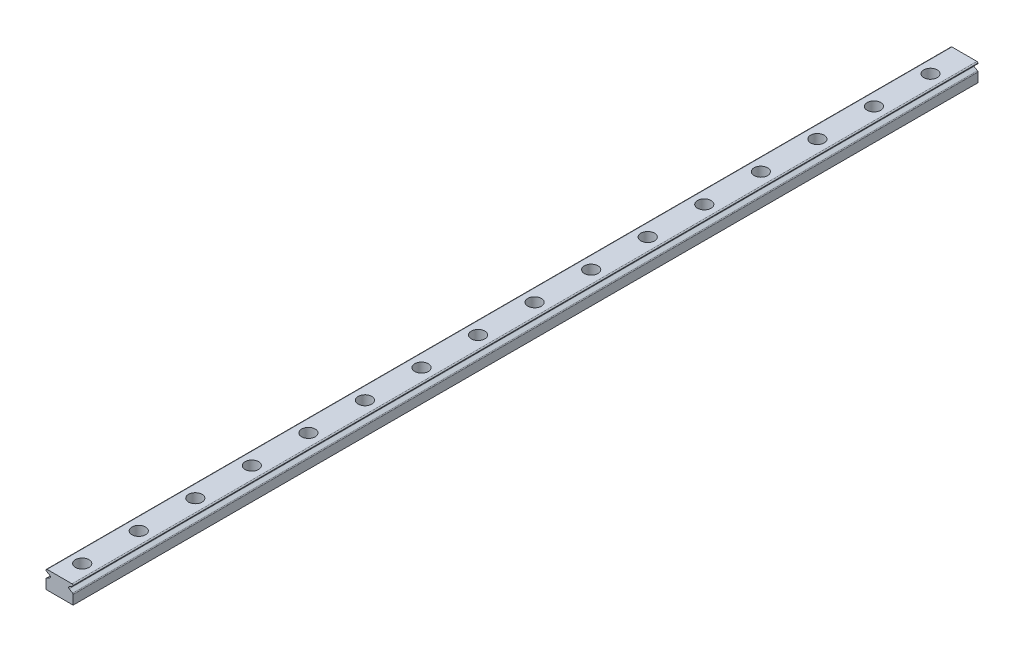
from build123d import *

# Parameters (mm, degrees)
BOSS_EXTRUDE2_DEPTH = 400
FILLET5_R           = 0.5
SKETCH3_R           = 3
CUT_EXTRUDE2_DEPTH  = 4.5
SKETCH4_R           = 1.75
CUT_EXTRUDE3_DEPTH  = 14.5
SKETCH5_W           = 12
SKETCH5_H           = 4.057387372
CUT_EXTRUDE4_DEPTH  = 682.5


with BuildPart() as part:
    # Sketch1 → Boss-Extrude2 (new body)
    with BuildSketch(Plane.XY):
        Polygon((0, 0), (12, 0), (12, 8.403449878), (9.5, 9.846825551), (12, 11.290201224), (12, 12), (0, 12), (0, 11.290201224), (2.5, 9.846825551), (0, 8.403449878), align=None)
    extrude(amount=BOSS_EXTRUDE2_DEPTH)

    # Fillet5
    # the kernel refuses this fillet: 0.5 mm, written as the material it adds along each edge
    with BuildSketch(Plane(origin=(2.5, 9.846825551, 0), x_dir=(-0.8660254037844382, 0.5000000000000009, 0), z_dir=(0, 0, 1)), Plane(origin=(9.5, 9.846825551, 0), x_dir=(0.8660254037844379, -0.5000000000000013, 0), z_dir=(0, 0, 1))) as fillet5_piece_1:
        with BuildLine():
            CenterArc((FILLET5_R * 1.73205080757, FILLET5_R), FILLET5_R, 150, 120)
            Line((FILLET5_R * 0.866025403784, FILLET5_R * 1.5), (0, 0))
            Line((0, 0), (FILLET5_R * 1.73205080757, 0))
        make_face()
    extrude(amount=400)
    # the kernel refuses this fillet: 0.5 mm, written as the material it takes off along each edge
    with BuildSketch(Plane(origin=(0, 8.403449878, -0.721687836), x_dir=(0, -1, 0), z_dir=(0, 0, 1))) as fillet5_2_piece_1:
        with BuildLine():
            CenterArc((FILLET5_R * 0.57735026919, FILLET5_R), FILLET5_R, 210, 60)
            Line((-FILLET5_R * 0.288675134595, FILLET5_R * 0.5), (0, 0))
            Line((0, 0), (FILLET5_R * 0.57735026919, 0))
        make_face()
    extrude(amount=401.443375673, mode=Mode.SUBTRACT)
    with BuildSketch(Plane(origin=(0, 11.290201224, -0.721687836), x_dir=(0, 1, 0), z_dir=(0, 0, 1)), Plane(origin=(12, 11.290201224, -0.721687836), x_dir=(-0.8660254037844355, -0.5000000000000052, 0), z_dir=(0, 0, 1)), Plane(origin=(12, 8.403449878, -0.721687836), x_dir=(0, -1, 0), z_dir=(0, 0, 1))) as fillet5_2_piece_2:
        with BuildLine():
            CenterArc((FILLET5_R * 0.57735026919, -FILLET5_R), FILLET5_R, 90, 60)
            Line((-FILLET5_R * 0.288675134595, -FILLET5_R * 0.5), (0, 0))
            Line((0, 0), (FILLET5_R * 0.57735026919, 0))
        make_face()
    extrude(amount=401.443375673, mode=Mode.SUBTRACT)
    with BuildSketch(Plane(origin=(0, 12, -1.25), x_dir=(1, 0, 0), z_dir=(0, 0, 1)), Plane(origin=(12, 12, -1.25), x_dir=(0, -1, 0), z_dir=(0, 0, 1))) as fillet5_2_piece_3:
        with BuildLine():
            CenterArc((FILLET5_R, -FILLET5_R), FILLET5_R, 90, 90)
            Line((0, -FILLET5_R), (0, 0))
            Line((0, 0), (FILLET5_R, 0))
        make_face()
    extrude(amount=402.5, mode=Mode.SUBTRACT)

    # Sketch3 → Cut-Extrude2 (cut)
    with BuildSketch(Plane(origin=(0, 12, 0), x_dir=(1, 0, 0), z_dir=(0, 1, 0))):
        with Locations((6, -490)):
            Circle(SKETCH3_R)
        with Locations((6, -440)):
            Circle(SKETCH3_R)
        with Locations((6, -415)):
            Circle(SKETCH3_R)
        with Locations(Location((6, -390, 0), (0, 0, 180))):
            Circle(SKETCH3_R)
        with Locations(Location((6, -365, 0), (0, 0, 180))):
            Circle(SKETCH3_R)
        with Locations(Location((6, -340, 0), (0, 0, 180))):
            Circle(SKETCH3_R)
        with Locations(Location((6, -315, 0), (0, 0, 180))):
            Circle(SKETCH3_R)
        with Locations(Location((6, -290, 0), (0, 0, 180))):
            Circle(SKETCH3_R)
        with Locations(Location((6, -265, 0), (0, 0, 180))):
            Circle(SKETCH3_R)
        with Locations(Location((6, -240, 0), (0, 0, 180))):
            Circle(SKETCH3_R)
        with Locations(Location((6, -215, 0), (0, 0, 180))):
            Circle(SKETCH3_R)
        with Locations(Location((6, -190, 0), (0, 0, 180))):
            Circle(SKETCH3_R)
        with Locations(Location((6, -165, 0), (0, 0, 180))):
            Circle(SKETCH3_R)
        with Locations(Location((6, -140, 0), (0, 0, 180))):
            Circle(SKETCH3_R)
        with Locations(Location((6, -115, 0), (0, 0, 180))):
            Circle(SKETCH3_R)
        with Locations(Location((6, -90, 0), (0, 0, 180))):
            Circle(SKETCH3_R)
        with Locations(Location((6, -65, 0), (0, 0, 180))):
            Circle(SKETCH3_R)
        with Locations(Location((6, -40, 0), (0, 0, 180))):
            Circle(SKETCH3_R)
        with Locations(Location((6, -15, 0), (0, 0, 180))):
            Circle(SKETCH3_R)
        with Locations((6, -465)):
            Circle(SKETCH3_R)
    extrude(amount=-CUT_EXTRUDE2_DEPTH, mode=Mode.SUBTRACT)

    # Sketch4 → Cut-Extrude3 (cut)
    with BuildSketch(Plane(origin=(0, 12, 0), x_dir=(1, 0, 0), z_dir=(0, 1, 0))):
        with Locations(Location((6, -15, 0), (0, 0, 180))):
            Circle(SKETCH4_R)
        with Locations(Location((6, -40, 0), (0, 0, 180))):
            Circle(SKETCH4_R)
        with Locations(Location((6, -65, 0), (0, 0, 180))):
            Circle(SKETCH4_R)
        with Locations(Location((6, -90, 0), (0, 0, 180))):
            Circle(SKETCH4_R)
        with Locations(Location((6, -115, 0), (0, 0, 180))):
            Circle(SKETCH4_R)
        with Locations(Location((6, -140, 0), (0, 0, 180))):
            Circle(SKETCH4_R)
        with Locations(Location((6, -165, 0), (0, 0, 180))):
            Circle(SKETCH4_R)
        with Locations(Location((6, -190, 0), (0, 0, 180))):
            Circle(SKETCH4_R)
        with Locations(Location((6, -215, 0), (0, 0, 180))):
            Circle(SKETCH4_R)
        with Locations(Location((6, -240, 0), (0, 0, 180))):
            Circle(SKETCH4_R)
        with Locations(Location((6, -265, 0), (0, 0, 180))):
            Circle(SKETCH4_R)
        with Locations(Location((6, -290, 0), (0, 0, 180))):
            Circle(SKETCH4_R)
        with Locations(Location((6, -315, 0), (0, 0, 180))):
            Circle(SKETCH4_R)
        with Locations(Location((6, -340, 0), (0, 0, 180))):
            Circle(SKETCH4_R)
        with Locations(Location((6, -365, 0), (0, 0, 180))):
            Circle(SKETCH4_R)
        with Locations(Location((6, -390, 0), (0, 0, 180))):
            Circle(SKETCH4_R)
        with Locations((6, -415)):
            Circle(SKETCH4_R)
        with Locations((6, -440)):
            Circle(SKETCH4_R)
        with Locations((6, -465)):
            Circle(SKETCH4_R)
        with Locations((6, -490)):
            Circle(SKETCH4_R)
    extrude(amount=-CUT_EXTRUDE3_DEPTH, mode=Mode.SUBTRACT)

    # Sketch5 → Cut-Extrude4 (cut)
    with BuildSketch(Plane(origin=(0, 0, 0), x_dir=(-1, 0, 0), z_dir=(0, 0, -1))):
        with Locations((-6, 2.028693686)):
            Rectangle(SKETCH5_W, SKETCH5_H)
    extrude(amount=-CUT_EXTRUDE4_DEPTH, mode=Mode.SUBTRACT)


solid = part.part
